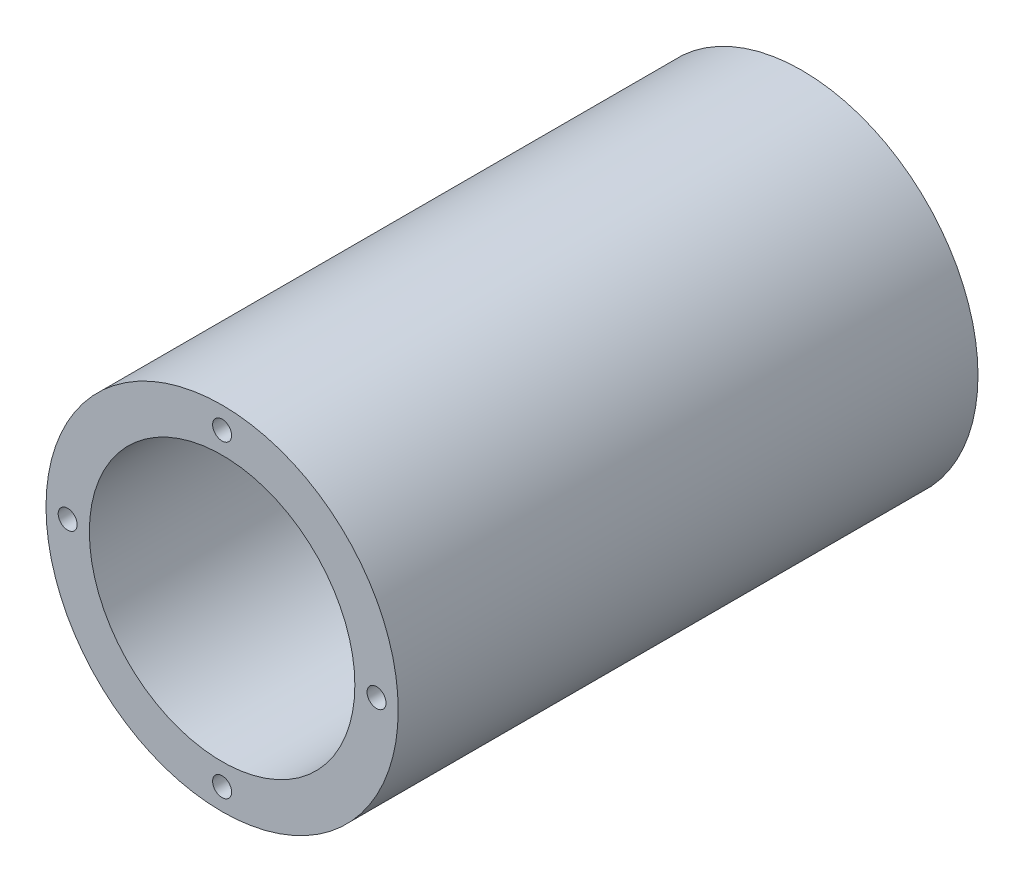
from build123d import *

# Parameters (mm, degrees)
CROQUIS1_R          = 32.5
CROQUIS1_R_2        = 24.5
BOSS_EXTRUDE1_DEPTH = 107
SKETCH1_R           = 1.5
CUT_EXTRUDE1_DEPTH  = 5
SKETCH2_R           = 1.75
CUT_EXTRUDE2_DEPTH  = 5


with BuildPart() as part:
    # Croquis1 → Boss-Extrude1 (new body)
    with BuildSketch(Plane.XY):
        Circle(CROQUIS1_R)
        Circle(CROQUIS1_R_2, mode=Mode.SUBTRACT)
    extrude(amount=BOSS_EXTRUDE1_DEPTH)

    # Sketch1 → Cut-Extrude1 (cut)
    with BuildSketch(Plane(origin=(0, 0, 0), x_dir=(-1, 0, 0), z_dir=(0, 0, -1))):
        with Locations((-28.5, 0)):
            Circle(SKETCH1_R)
        with Locations((0, 28.5)):
            Circle(SKETCH1_R)
        with Locations((28.5, 0)):
            Circle(SKETCH1_R)
        with Locations((0, -28.5)):
            Circle(SKETCH1_R)
    extrude(amount=-CUT_EXTRUDE1_DEPTH, mode=Mode.SUBTRACT)

    # Sketch2 → Cut-Extrude2 (cut)
    with BuildSketch(Plane.XY.offset(107)):
        with Locations((-28.5, 0)):
            Circle(SKETCH2_R)
        with Locations((0, 28.5)):
            Circle(SKETCH2_R)
        with Locations((28.5, 0)):
            Circle(SKETCH2_R)
        with Locations((0, -28.5)):
            Circle(SKETCH2_R)
    extrude(amount=-CUT_EXTRUDE2_DEPTH, mode=Mode.SUBTRACT)


solid = part.part
